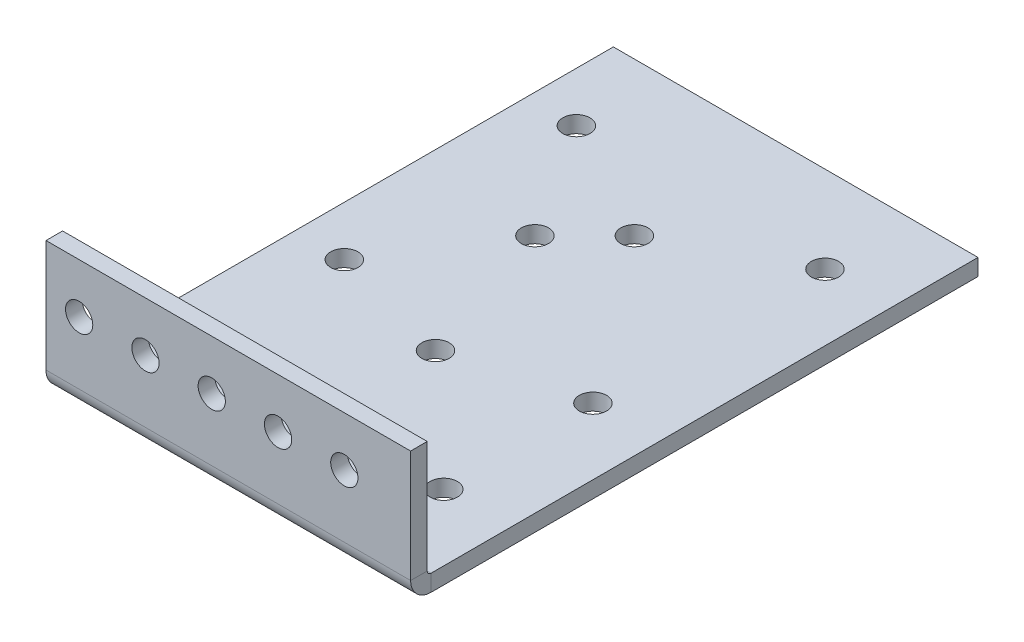
from build123d import *

# Parameters (mm, degrees)
SKETCH1_W                   = 69.85
SKETCH1_H                   = 101.6
BASE_FLANGE1_DEPTH          = 3.175
EDGE_FLANGE1_DEPTH          = 69.85
F_5_0_2055_DIAMETER_HOLE1_D = 5.2197
F_5_0_2055_DIAMETER_HOLE3_D = 5.2197
SKETCH21_R                  = 2.60985
CUT_EXTRUDE1_DEPTH          = 126.88384527


# Sheet-metal steps are written as plain solids
with BuildPart() as part:
    # Sketch1 → Base-Flange1 (new body)
    with BuildSketch(Plane(origin=(0, 0, 0), x_dir=(1, 0, 0), z_dir=(0, 1, 0))):
        with Locations((34.925, 50.8)):
            Rectangle(SKETCH1_W, SKETCH1_H)
    extrude(amount=-BASE_FLANGE1_DEPTH)

    # Edge-Flange1 section (across the edge) → Edge-Flange1 (add)
    with BuildSketch(Plane(origin=(0, 0, 3.9116), x_dir=(0, 0, -1), z_dir=(1, 0, 0))):
        with BuildLine():
            Line((-3.175, 0.7366), (-3.175, 22.225))
            Line((-3.175, 22.225), (0, 22.225))
            Line((0, 22.225), (0, 0.7366))
            ThreePointArc((0, 0.7366), (0.215745145, 0.215745145), (0.7366, 0))
            Line((0.7366, 0), (3.9116, 0))
            Line((3.9116, 0), (3.9116, -3.175))
            Line((3.9116, -3.175), (0.7366, -3.175))
            ThreePointArc((0.7366, -3.175), (-2.029318885, -2.029318885), (-3.175, 0.7366))
        make_face()
    extrude(amount=EDGE_FLANGE1_DEPTH)

    # #5 (0.2055) Diameter Hole1 (through all)
    with Locations(Plane.XZ.offset(3.175)):
        with Locations((33.3375, -34.1884), (23.8125, -62.7634), (33.3375, -72.2884), (57.15, -84.9884), (57.15, -40.5384), (9.525, -40.5384), (9.525, -84.9884)):
            Hole(F_5_0_2055_DIAMETER_HOLE1_D / 2)

    # #5 (0.2055) Diameter Hole3 (through all)
    with Locations(Plane.XY.offset(7.0866)):
        with Locations((6.35, 12.7), (19.05, 12.7), (31.75, 12.7), (44.45, 12.7), (57.15, 12.7)):
            Hole(F_5_0_2055_DIAMETER_HOLE3_D / 2)

    # Sketch21 → Cut-Extrude1 (cut, through all)
    with BuildSketch(Plane.XZ.offset(3.175)):
        with Locations(Location((19.050000049, -11.9634, 0), (0, 0, 270))):
            Circle(SKETCH21_R)
        with Locations(Location((6.350000049, -11.9634, 0), (0, 0, 270))):
            Circle(SKETCH21_R)
        with Locations(Location((31.750000049, -11.9634, 0), (0, 0, 270))):
            Circle(SKETCH21_R)
        with Locations(Location((44.450000049, -11.9634, 0), (0, 0, 270))):
            Circle(SKETCH21_R)
        with Locations(Location((57.150000049, -11.9634, 0), (0, 0, 270))):
            Circle(SKETCH21_R)
    extrude(amount=-CUT_EXTRUDE1_DEPTH, mode=Mode.SUBTRACT)


solid = part.part
